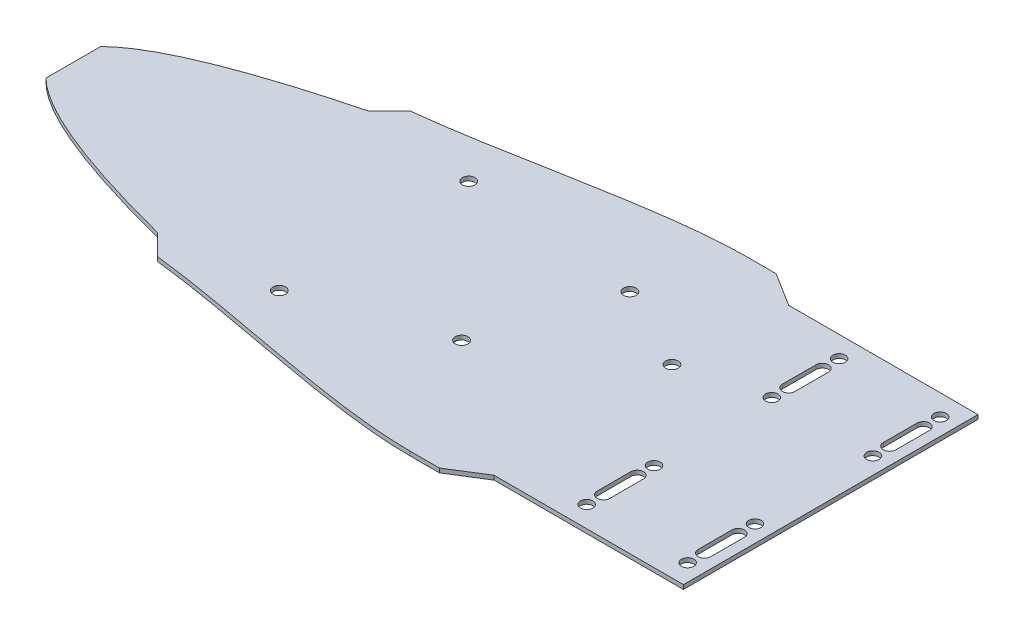
from build123d import *

# Parameters (mm, degrees)
EXTRUDE_671_DEPTH      = 1
CUT_EXTRUDE_1801_DEPTH = 99.493654618
SKETCH_3_R             = 1.475
CUT_EXTRUDE_2465_DEPTH = 99.493654751
SKETCH_6_R             = 1.5
CUT_EXTRUDE_3140_DEPTH = 99.493654751
SKETCH_5_R             = 1.5
CUT_EXTRUDE_3376_DEPTH = 3


with BuildPart() as part:
    # Эскиз1 → Extrude 671 (new body)
    with BuildSketch(Plane(origin=(0, 0, 0), x_dir=(1, 0, 0), z_dir=(0, 1, 0))):
        Polygon((45, -35), (90, -35), (90, 35), (45, 35), (37, 40), (-90, 40), (-90, -40), (37, -40), align=None)
    extrude(amount=EXTRUDE_671_DEPTH)

    # Эскиз2 → Cut-Extrude 1801 (cut, through all)
    with BuildSketch(Plane(origin=(0, 0, 0), x_dir=(1, 0, 0), z_dir=(0, 1, 0))):
        with BuildLine():
            add(Edge.make_bspline(
                [(-45, -25.026666558), (-80.732219919, -15.758886484), (-89.999999997, -6.49110641)],
                knots=[0.187166668, 0.187166668, 0.187166668, 0.41886117, 0.41886117, 0.41886117], degree=2))
            Line((-90, -6.491106412), (-90, -40))
            Line((-90, -40), (30, -40))
            add(Edge.make_bspline(
                [(-40, -30), (-18.106480661, -32.388528671), (9.780404795, -40), (30, -40)],
                knots=[0, 0, 0, 0, 1, 1, 1, 1], degree=3))
            Line((-40, -30), (-45, -25.026666559))
        make_face()
        with BuildLine():
            Line((-90, 40), (-90, 6.491106412))
            add(Edge.make_bspline(
                [(-89.999999997, 6.49110641), (-80.732219919, 15.758886484), (-45, 25.026666558)],
                knots=[0.58113883, 0.58113883, 0.58113883, 0.812833332, 0.812833332, 0.812833332], degree=2))
            Line((-45, 25.026666559), (-40, 30))
            add(Edge.make_bspline(
                [(-40, 30), (-18.106480661, 32.388528671), (9.780404795, 40), (30, 40)],
                knots=[0, 0, 0, 0, 1, 1, 1, 1], degree=3))
            Line((30, 40), (-90, 40))
        make_face()
    extrude(amount=CUT_EXTRUDE_1801_DEPTH, mode=Mode.SUBTRACT)

    # Эскиз3 → Cut-Extrude 2465 (cut, through all)
    with BuildSketch(Plane(origin=(0, 0, 0), x_dir=(1, 0, 0), z_dir=(0, 1, 0))):
        with Locations((62, 30)):
            Circle(SKETCH_3_R)
        with Locations((62, 14)):
            Circle(SKETCH_3_R)
        with Locations((86, 14)):
            Circle(SKETCH_3_R)
        with Locations((86, 30)):
            Circle(SKETCH_3_R)
        with Locations((86, -14)):
            Circle(SKETCH_3_R)
        with Locations((86, -30)):
            Circle(SKETCH_3_R)
        with Locations((62, -14)):
            Circle(SKETCH_3_R)
        with Locations((62, -30)):
            Circle(SKETCH_3_R)
        with BuildLine():
            Line((63.5, 26), (63.5, 18))
            ThreePointArc((63.5, 18), (62, 16.5), (60.5, 18))
            Line((60.5, 18), (60.5, 26))
            ThreePointArc((60.5, 26), (62, 27.5), (63.5, 26))
        make_face()
        with BuildLine():
            Line((84.5, 26), (84.5, 18))
            ThreePointArc((84.5, 18), (86, 16.5), (87.5, 18))
            Line((87.5, 18), (87.5, 26))
            ThreePointArc((87.5, 26), (86, 27.5), (84.5, 26))
        make_face()
        with BuildLine():
            Line((63.5, -26), (63.5, -18))
            ThreePointArc((63.5, -18), (62, -16.5), (60.5, -18))
            Line((60.5, -18), (60.5, -26))
            ThreePointArc((60.5, -26), (62, -27.5), (63.5, -26))
        make_face()
        with BuildLine():
            Line((84.5, -26), (84.5, -18))
            ThreePointArc((84.5, -18), (86, -16.5), (87.5, -18))
            Line((87.5, -18), (87.5, -26))
            ThreePointArc((87.5, -26), (86, -27.5), (84.5, -26))
        make_face()
    extrude(amount=CUT_EXTRUDE_2465_DEPTH, mode=Mode.SUBTRACT)

    # Эскиз6 → Cut-Extrude 3140 (cut, through all)
    with BuildSketch(Plane(origin=(0, 1, 0), x_dir=(1, 0, 0), z_dir=(0, 1, 0))):
        with Locations((23.349368044, 18.918214355)):
            Circle(SKETCH_6_R)
        with Locations((13.349368044, -11.081785645)):
            Circle(SKETCH_6_R)
        with Locations((43.349368044, 8.918214355)):
            Circle(SKETCH_6_R)
    extrude(amount=-CUT_EXTRUDE_3140_DEPTH, mode=Mode.SUBTRACT)

    # Эскиз5 → Cut-Extrude 3376 (cut)
    with BuildSketch(Plane(origin=(0, 0, 0), x_dir=(1, 0, 0), z_dir=(0, 1, 0))):
        with Locations((-18.541302758, 22.5)):
            Circle(SKETCH_5_R)
        with Locations((-18.541302758, -22.5)):
            Circle(SKETCH_5_R)
    extrude(amount=CUT_EXTRUDE_3376_DEPTH, mode=Mode.SUBTRACT)


solid = part.part
